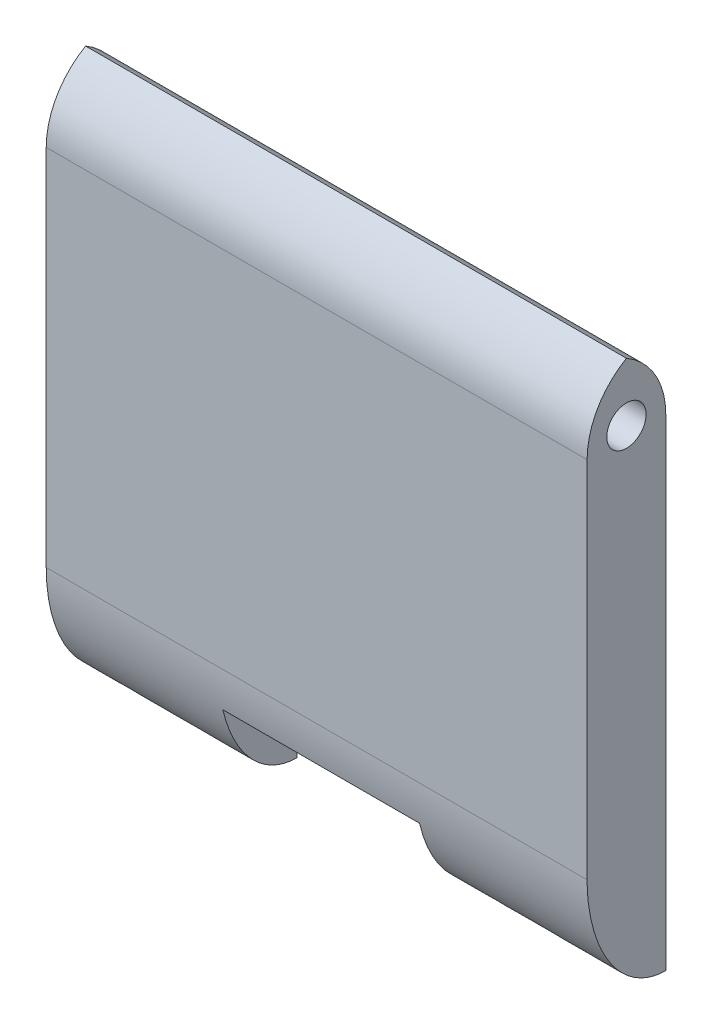
from build123d import *

# Parameters (mm, degrees)
BOSS_EXTRUDE1_DEPTH = 8
SKETCH2_R           = 2
CUT_EXTRUDE1_DEPTH  = 63.459987192
FILLET3_R           = 8
FILLET4_START       = -27.5
FILLET4_DEPTH       = 55


with BuildPart() as part:
    # Sketch1 → Boss-Extrude1 (new body)
    with BuildSketch(Plane.XY):
        Polygon((-27.5, 28.5), (-27.5, -28.5), (-10, -28.5), (-10, -20.5), (10, -20.5), (10, -28.5), (27.5, -28.5), (27.5, 28.5), align=None)
    extrude(amount=BOSS_EXTRUDE1_DEPTH)

    # Sketch2 → Cut-Extrude1 (cut, through all)
    with BuildSketch(Plane(origin=(27.5, 0, 0), x_dir=(0, 0, -1), z_dir=(1, 0, 0))):
        with Locations((-4, 21.5)):
            Circle(SKETCH2_R)
    extrude(amount=-CUT_EXTRUDE1_DEPTH, mode=Mode.SUBTRACT)

    # Fillet3
    # the kernel refuses this fillet: 8 mm, written as the material it takes off along each edge
    with BuildSketch(Plane(origin=(47.5, 28.5, 8), x_dir=(0, 0, -1), z_dir=(-1, 0, 0))) as fillet3_piece_1:
        with BuildLine():
            CenterArc((FILLET3_R, FILLET3_R), FILLET3_R, 180, 90)
            Line((0, FILLET3_R), (0, 0))
            Line((0, 0), (FILLET3_R, 0))
        make_face()
    extrude(amount=95, mode=Mode.SUBTRACT)
    with BuildSketch(Plane(origin=(47.5, 28.5, 0), x_dir=(0, 0, 1), z_dir=(-1, 0, 0))) as fillet3_piece_2:
        with BuildLine():
            CenterArc((FILLET3_R, -FILLET3_R), FILLET3_R, 90, 90)
            Line((0, -FILLET3_R), (0, 0))
            Line((0, 0), (FILLET3_R, 0))
        make_face()
    extrude(amount=95, mode=Mode.SUBTRACT)

    # Fillet4: read off the stored shape, not the designer's step
    # Fillet4 outline → Fillet4 (cut)
    with BuildSketch(Plane.YZ.offset(FILLET4_START)):
        with BuildLine():
            Line((-28.5, 8), (-28.5, 0))
            add(Edge.make_bspline(
                [(-28.5, 0), (-28.5, 8), (-16.5, 8)],
                knots=[0, 0, 0, 1, 1, 1], degree=2, weights=[1, 0.707106781, 1]))
            Line((-16.5, 8), (-28.5, 8))
        make_face()
    extrude(amount=FILLET4_DEPTH, mode=Mode.SUBTRACT)


solid = part.part
